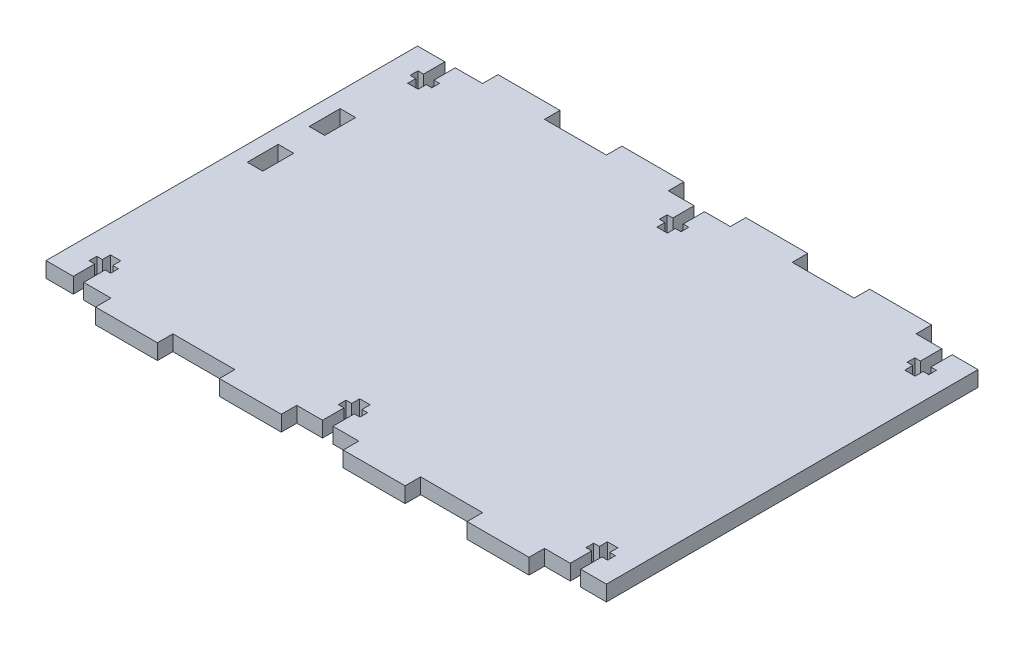
from build123d import *

# Parameters (mm, degrees)
SKETCH1_W           = 229.859874896
SKETCH1_H           = 6.35
BOSS_EXTRUDE1_DEPTH = 152.4
SKETCH2_W           = 25.4
SKETCH2_H           = 6.35
BOSS_EXTRUDE2_DEPTH = 6.35
LPATTERN1_COUNT     = 4
LPATTERN1_PITCH     = 50.8
SKETCH3_W           = 25.4
SKETCH3_H           = 6.35
BOSS_EXTRUDE3_DEPTH = 6.35
LPATTERN2_COUNT     = 4
LPATTERN2_PITCH     = 50.8
CUT_EXTRUDE1_DEPTH  = 6.35
SKETCH5_W           = 6.35
SKETCH5_H           = 12.7
CUT_EXTRUDE2_DEPTH  = 212.329778686


with BuildPart() as part:
    # Sketch1 → Boss-Extrude1 (new body)
    with BuildSketch(Plane.XY):
        with Locations((-24.419947229, 152.4)):
            Rectangle(SKETCH1_W, SKETCH1_H)
    extrude(amount=BOSS_EXTRUDE1_DEPTH)

    # Sketch2 → Boss-Extrude2 (add)
    with BuildSketch(Plane(origin=(0, 155.575, 0), x_dir=(1, 0, 0), z_dir=(0, 1, 0))):
        with Locations((52.409990219, 3.175)):
            Rectangle(SKETCH2_W, SKETCH2_H)
    boss_extrude2 = extrude(amount=-BOSS_EXTRUDE2_DEPTH)

    # LPattern1: Boss-Extrude2 ×4
    with Locations(*[(-i * LPATTERN1_PITCH, 0, 0) for i in range(1, LPATTERN1_COUNT)]):
        add(boss_extrude2)

    # Sketch3 → Boss-Extrude3 (add)
    with BuildSketch(Plane.XY.offset(152.4)):
        with Locations((52.409990219, 152.4)):
            Rectangle(SKETCH3_W, SKETCH3_H)
    boss_extrude3 = extrude(amount=BOSS_EXTRUDE3_DEPTH)

    # LPattern2: Boss-Extrude3 ×4
    with Locations(*[(-i * LPATTERN2_PITCH, 0, 0) for i in range(1, LPATTERN2_COUNT)]):
        add(boss_extrude3)

    # Sketch4 → Cut-Extrude1 (cut)
    with BuildSketch(Plane(origin=(0, 155.575, 0), x_dir=(1, 0, 0), z_dir=(0, 1, 0))):
        Polygon((-123.886347229, 0), (-128.153547229, 0), (-128.153547229, -8.763), (-130.464947229, -8.763), (-130.464947229, -11.938), (-128.153547229, -11.938), (-128.153547229, -15.24), (-123.886347229, -15.24), (-123.886347229, -11.938), (-121.574947229, -11.938), (-121.574947229, -8.763), (-123.886347229, -8.763), align=None)
        Polygon((-21.656409781, 0), (-25.923609781, 0), (-25.923609781, -8.763), (-28.235009781, -8.763), (-28.235009781, -11.938), (-25.923609781, -11.938), (-25.923609781, -15.24), (-21.656409781, -15.24), (-21.656409781, -11.938), (-19.345009781, -11.938), (-19.345009781, -8.763), (-21.656409781, -8.763), align=None)
        Polygon((79.943590219, 0), (75.676390219, 0), (75.676390219, -8.763), (73.364990219, -8.763), (73.364990219, -11.938), (75.676390219, -11.938), (75.676390219, -15.24), (79.943590219, -15.24), (79.943590219, -11.938), (82.254990219, -11.938), (82.254990219, -8.763), (79.943590219, -8.763), align=None)
        Polygon((-128.153547229, -152.4), (-123.886347229, -152.4), (-123.886347229, -143.637), (-121.574947229, -143.637), (-121.574947229, -140.462), (-123.886347229, -140.462), (-123.886347229, -137.16), (-128.153547229, -137.16), (-128.153547229, -140.462), (-130.464947229, -140.462), (-130.464947229, -143.637), (-128.153547229, -143.637), align=None)
        Polygon((-25.923609781, -152.4), (-21.656409781, -152.4), (-21.656409781, -143.637), (-19.345009781, -143.637), (-19.345009781, -140.462), (-21.656409781, -140.462), (-21.656409781, -137.16), (-25.923609781, -137.16), (-25.923609781, -140.462), (-28.235009781, -140.462), (-28.235009781, -143.637), (-25.923609781, -143.637), align=None)
        Polygon((75.676390219, -152.4), (79.943590219, -152.4), (79.943590219, -143.637), (82.254990219, -143.637), (82.254990219, -140.462), (79.943590219, -140.462), (79.943590219, -137.16), (75.676390219, -137.16), (75.676390219, -140.462), (73.364990219, -140.462), (73.364990219, -143.637), (75.676390219, -143.637), align=None)
    extrude(amount=-CUT_EXTRUDE1_DEPTH, mode=Mode.SUBTRACT)

    # Sketch5 → Cut-Extrude2 (cut, through all)
    with BuildSketch(Plane(origin=(0, 155.575, 0), x_dir=(1, 0, 0), z_dir=(0, 1, 0))):
        with Locations((-129.824884677, -44.45)):
            Rectangle(SKETCH5_W, SKETCH5_H)
        with Locations((-129.824884677, -69.85)):
            Rectangle(SKETCH5_W, SKETCH5_H)
    extrude(amount=-CUT_EXTRUDE2_DEPTH, mode=Mode.SUBTRACT)


solid = part.part
